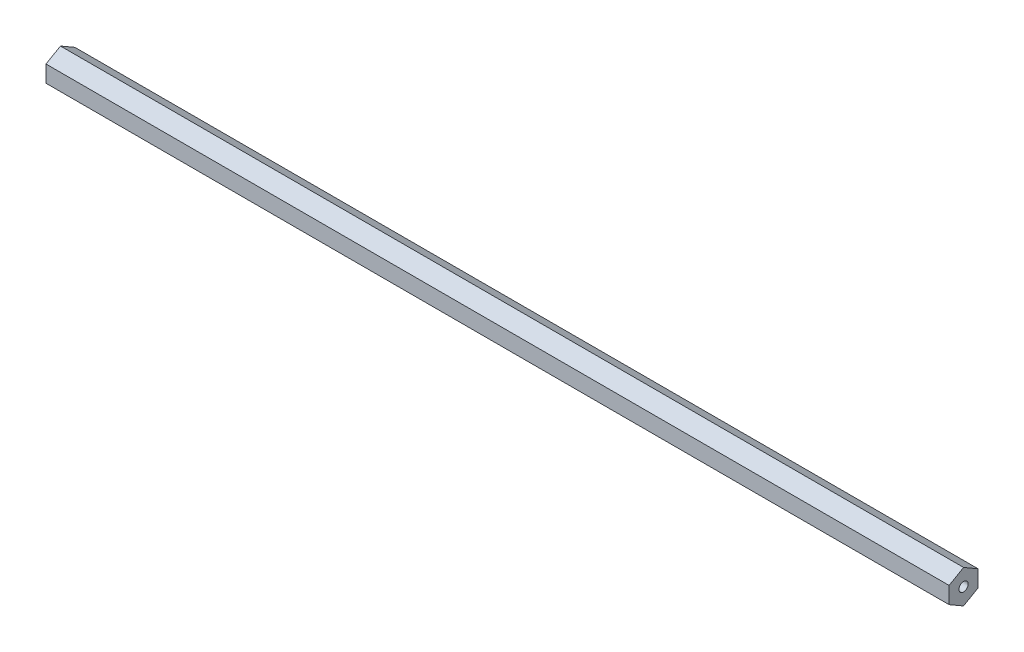
from build123d import *

# Parameters (mm, degrees)
BOSS_EXTRUDE1_DEPTH                  = 198.4375
F_10_32_TAPPED_HOLE1_D               = 4.0386
F_10_32_TAPPED_HOLE1_DEPTH           = 12.02944
F_10_32_TAPPED_HOLE1_TIP             = 1.213317848
F_10_32_TAPPED_HOLE1_ON_FACE_2_D     = 4.0386
F_10_32_TAPPED_HOLE1_ON_FACE_2_DEPTH = 12.02944
F_10_32_TAPPED_HOLE1_ON_FACE_2_TIP   = 1.213317848


with BuildPart() as part:
    # Sketch1 → Boss-Extrude1 (new, symmetric)
    with BuildSketch(Plane(origin=(0, 0, 0), x_dir=(0, 0, -1), z_dir=(1, 0, 0))):
        Polygon((0, 7.332348419), (-6.35, 3.666174209), (-6.35, -3.666174209), (0, -7.332348419), (6.35, -3.666174209), (6.35, 3.666174209), align=None)
    extrude(amount=BOSS_EXTRUDE1_DEPTH, both=True)

    # #10-32 Tapped Hole1
    with Locations(Plane(origin=(198.4375, 0, 0), x_dir=(0, 0, 1), z_dir=(1, 0, 0))):
        with Locations((0, 0)):
            Hole(F_10_32_TAPPED_HOLE1_D / 2, depth=F_10_32_TAPPED_HOLE1_DEPTH)
            with Locations((0, 0, -(F_10_32_TAPPED_HOLE1_DEPTH + F_10_32_TAPPED_HOLE1_TIP / 2))):  # 118° drill point
                Cone(0, F_10_32_TAPPED_HOLE1_D / 2, F_10_32_TAPPED_HOLE1_TIP, mode=Mode.SUBTRACT)

    # #10-32 Tapped Hole1 on face 2
    with Locations(Plane(origin=(-198.4375, 0, 0), x_dir=(0, 0, -1), z_dir=(-1, 0, 0))):
        with Locations((0, 0)):
            Hole(F_10_32_TAPPED_HOLE1_ON_FACE_2_D / 2, depth=F_10_32_TAPPED_HOLE1_ON_FACE_2_DEPTH)
            with Locations((0, 0, -(F_10_32_TAPPED_HOLE1_ON_FACE_2_DEPTH + F_10_32_TAPPED_HOLE1_ON_FACE_2_TIP / 2))):  # 118° drill point
                Cone(0, F_10_32_TAPPED_HOLE1_ON_FACE_2_D / 2, F_10_32_TAPPED_HOLE1_ON_FACE_2_TIP, mode=Mode.SUBTRACT)


solid = part.part
